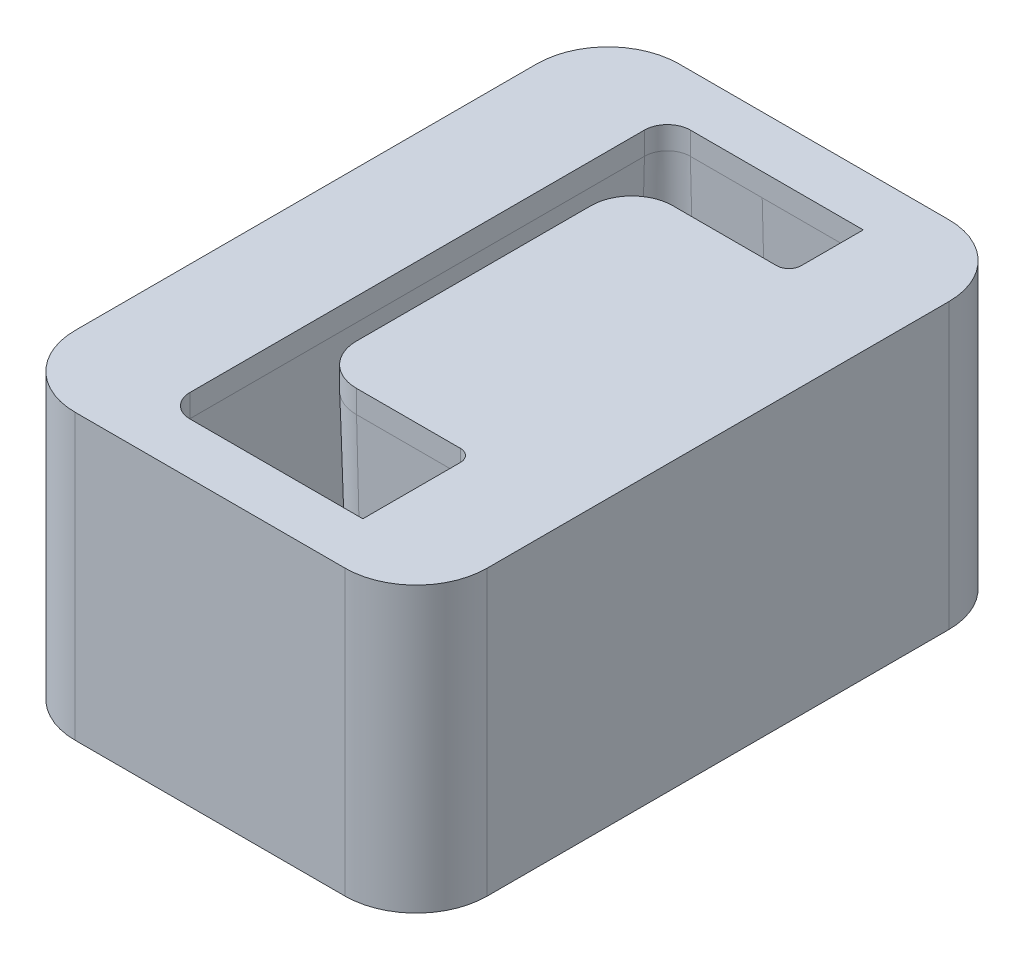
from build123d import *

# Parameters (mm, degrees)
SKETCH1_W                   = 58
SKETCH1_H                   = 85
BOSS_EXTRUDE1_DEPTH         = 40
FILLET1_R                   = 10
CUT_EXTRUDE1_REACH          = 67.171
M6_TAPPED_HOLE1_D           = 5
M6_TAPPED_HOLE1_DEPTH       = 17
M6_TAPPED_HOLE1_CSINK_D     = 6.05
M6_TAPPED_HOLE1_CSINK_ANGLE = 90
M6_TAPPED_HOLE1_TIP         = 1.502151548


with BuildPart() as part:
    # Sketch1 → Boss-Extrude1 (new body)
    with BuildSketch(Plane(origin=(0, 0, 0), x_dir=(1, 0, 0), z_dir=(0, 1, 0))):
        Rectangle(SKETCH1_W, SKETCH1_H)
    extrude(amount=-BOSS_EXTRUDE1_DEPTH)

    # Fillet1
    fillet1_edges = [part.edges().sort_by_distance(p)[0] for p in [
        (-29, -20, -42.5),
        (29, -20, -42.5),
        (29, -20, 42.5),
        (-29, -20, 42.5),
    ]]
    fillet(fillet1_edges, radius=FILLET1_R)

    # Sketch2 → Cut-Extrude1 (cut, up to next)
    with BuildSketch(Plane(origin=(0, 0, 0), x_dir=(1, 0, 0), z_dir=(0, 1, 0)), mode=Mode.PRIVATE) as cut_extrude1_sk1:
        with BuildLine():
            Line((14.23, 35.23), (-10.12, 35.23))
            ThreePointArc((-10.12, 35.23), (-12.403954903, 34.283954903), (-13.35, 32))
            Line((-13.35, 32), (-13.35, -32))
            ThreePointArc((-13.35, -32), (-12.403954903, -34.283954903), (-10.12, -35.23))
            Line((-10.12, -35.23), (14.23, -35.23))
            Line((14.23, -35.23), (14.23, -21.5))
            ThreePointArc((14.23, -21.5), (13.723294731, -20.276705269), (12.5, -19.77))
            Line((12.5, -19.77), (-2.12, -19.77))
            ThreePointArc((-2.12, -19.77), (-6.200006127, -18.080006127), (-7.89, -14))
            Line((-7.89, -14), (-7.89, 19))
            ThreePointArc((-7.89, 19), (-6.200006127, 23.080006127), (-2.12, 24.77))
            Line((-2.12, 24.77), (12.5, 24.77))
            ThreePointArc((12.5, 24.77), (13.723294731, 25.276705269), (14.23, 26.5))
            Line((14.23, 26.5), (14.23, 35.23))
        make_face()
    cut_extrude1_tool1 = extrude(cut_extrude1_sk1.sketch, amount=-CUT_EXTRUDE1_REACH, mode=Mode.PRIVATE) & part.part
    add(cut_extrude1_tool1.solids().sort_by_distance((-6.735042, 0, -23.615042))[0], mode=Mode.SUBTRACT)

    # Cut-Sweep1: sweep along a path in Sketch5
    with BuildLine(Plane(origin=(0, 0, 0), x_dir=(1, 0, 0), z_dir=(0, 1, 0))) as cut_sweep1_path:
        Line((12.5, -19.77), (-2.12, -19.77))
        ThreePointArc((-2.12, -19.77), (-6.200006127, -18.080006127), (-7.89, -14))
        Line((-7.89, -14), (-7.89, 19))
        ThreePointArc((-7.89, 19), (-6.200006127, 23.080006127), (-2.12, 24.77))
        Line((-2.12, 24.77), (12.5, 24.77))
        ThreePointArc((12.5, 24.77), (13.723294731, 25.276705269), (14.23, 26.5))
        Line((14.23, 26.5), (14.23, 35.23))
        Line((14.23, 35.23), (-10.12, 35.23))
        ThreePointArc((-10.12, 35.23), (-12.403954903, 34.283954903), (-13.35, 32))
        Line((-13.35, 32), (-13.35, -32))
        ThreePointArc((-13.35, -32), (-12.403954903, -34.283954903), (-10.12, -35.23))
        Line((-10.12, -35.23), (14.23, -35.23))
        Line((14.23, -35.23), (14.23, -21.5))
        ThreePointArc((14.23, -21.5), (13.723294731, -20.276705269), (12.5, -19.77))
    # Sketch3 → Cut-Sweep1 (sweep, cut)
    with BuildSketch(Plane(origin=(0, 0, 0), x_dir=(0, 0, -1), z_dir=(1, 0, 0))):
        Polygon((35.23, -3.2), (36.193641914, -40), (35.23, -40), align=None)
    sweep(path=cut_sweep1_path.line, transition=Transition.RIGHT, mode=Mode.SUBTRACT)

    # M6 Tapped Hole1
    with Locations(Plane(origin=(0, -40, 0), x_dir=(-1, 0, 0), z_dir=(0, -1, 0))):
        with Locations((-22, 35.5), (22, 35.5), (22, -35.5), (-22, -35.5)):
            CounterSinkHole(M6_TAPPED_HOLE1_D / 2, M6_TAPPED_HOLE1_CSINK_D / 2, depth=M6_TAPPED_HOLE1_DEPTH, counter_sink_angle=M6_TAPPED_HOLE1_CSINK_ANGLE)
            with Locations((0, 0, -(M6_TAPPED_HOLE1_DEPTH + M6_TAPPED_HOLE1_TIP / 2))):  # 118° drill point
                Cone(0, M6_TAPPED_HOLE1_D / 2, M6_TAPPED_HOLE1_TIP, mode=Mode.SUBTRACT)


solid = part.part
